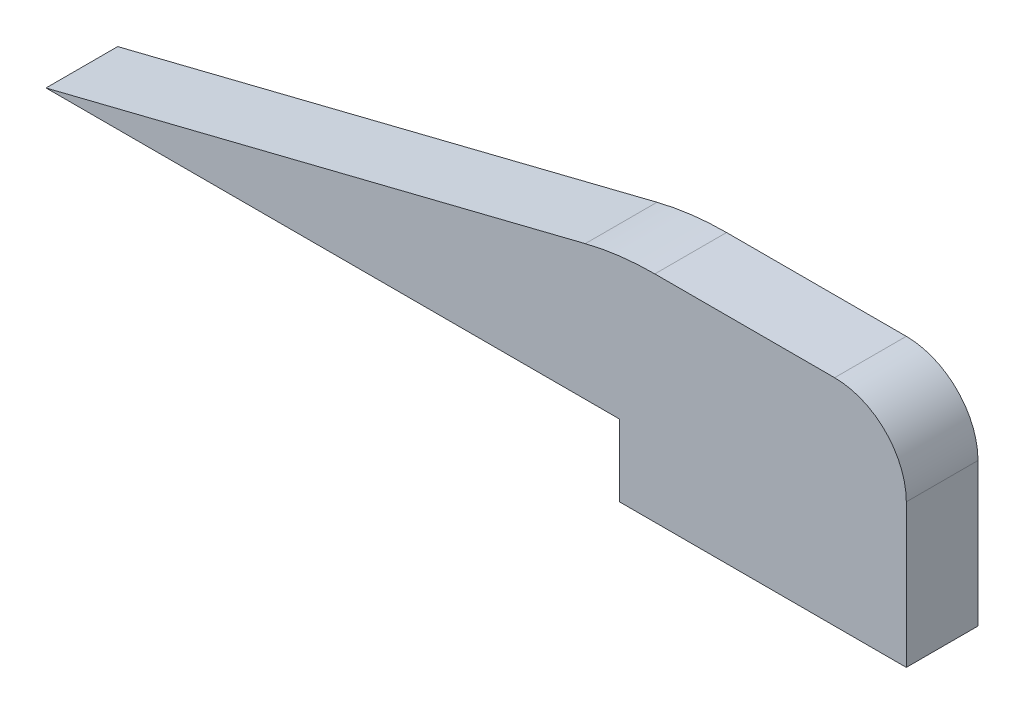
from build123d import *

# Parameters (mm, degrees)
BOSS_EXTRUDE1_DEPTH = 3.175


with BuildPart() as part:
    # Sketch1 → Boss-Extrude1 (new body)
    with BuildSketch(Plane.XY):
        with BuildLine():
            Line((0, 0), (23.883239007, 5.970809752))
            ThreePointArc((23.883239007, 5.970809752), (25.411713996, 6.25484597), (26.963441445, 6.35))
            Line((26.963441445, 6.35), (34.925, 6.35))
            ThreePointArc((34.925, 6.35), (37.17006403, 5.42006403), (38.1, 3.175))
            Line((38.1, 3.175), (38.1, -3.175))
            Line((38.1, -3.175), (25.4, -3.175))
            Line((25.4, -3.175), (25.4, 0))
            Line((25.4, 0), (0, 0))
        make_face()
    extrude(amount=BOSS_EXTRUDE1_DEPTH)


solid = part.part
